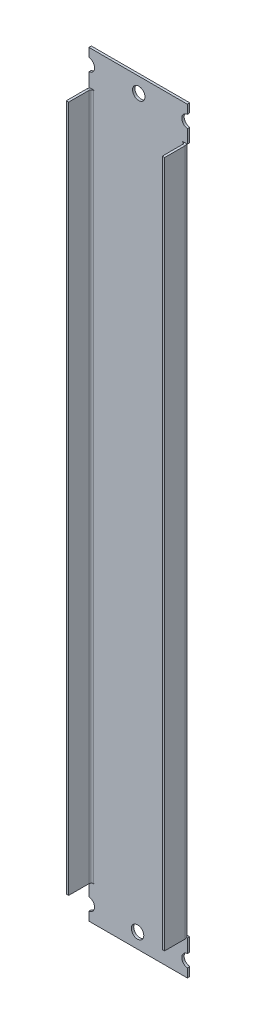
from build123d import *

# Parameters (mm, degrees)
CROQUIS1_W                          = 62.738
CROQUIS1_H                          = 482.6
CROQUIS1_R                          = 3.9624
BRIDA_BASE1_DEPTH                   = 1.524
BRIDA_DE_ARISTA1_STRIP_W            = 9.144
BRIDA_DE_ARISTA1_STRIP_H            = 1.524
BRIDA_DE_ARISTA1_STRIP_CUT_DEPTH    = 438.15
BRIDA_DE_ARISTA1_RELIEF_W           = 9.2964
BRIDA_DE_ARISTA1_RELIEF_H           = 0.1524
BRIDA_DE_ARISTA1_RELIEF_CUT_DEPTH   = 1.524
BRIDA_DE_ARISTA1_STRIP_2_W          = 9.144
BRIDA_DE_ARISTA1_STRIP_2_H          = 1.524
BRIDA_DE_ARISTA1_STRIP_CUT_2_DEPTH  = 438.15
BRIDA_DE_ARISTA1_RELIEF_2_W         = 9.2964
BRIDA_DE_ARISTA1_RELIEF_2_H         = 0.1524
BRIDA_DE_ARISTA1_RELIEF_CUT_2_DEPTH = 1.524
BRIDA_DE_ARISTA1_DEPTH              = 438.15
BRIDA_DE_ARISTA1_BEND_DEPTH         = 438.15
CROQUIS15_R                         = 3.9624
CORTAR_EXTRUIR1_DEPTH               = 244.760777495


# Sheet-metal steps are written as plain solids
with BuildPart() as part:
    # Croquis1 → Brida base1 (new body)
    with BuildSketch(Plane.XY):
        Rectangle(CROQUIS1_W, CROQUIS1_H)
        with Locations((0.381, 231.775)):
            Circle(CROQUIS1_R, mode=Mode.SUBTRACT)
        with Locations((-0.381, -231.775)):
            Circle(CROQUIS1_R, mode=Mode.SUBTRACT)
    extrude(amount=-BRIDA_BASE1_DEPTH)

    # Brida de arista1 strip (across the edge) → Brida de arista1 strip cut (cut)
    with BuildSketch(Plane(origin=(31.369, -219.075, 0), x_dir=(-1, 0, 0), z_dir=(0, 1, 0))):
        with Locations((-1.524, -0.762)):
            Rectangle(BRIDA_DE_ARISTA1_STRIP_W, BRIDA_DE_ARISTA1_STRIP_H)
    extrude(amount=BRIDA_DE_ARISTA1_STRIP_CUT_DEPTH, mode=Mode.SUBTRACT)

    # Brida de arista1 relief (on the sheet) → Brida de arista1 relief cut (cut)
    with BuildSketch(Plane(origin=(28.321, -219.075, 0), x_dir=(-1, 0, 0), z_dir=(0, 0, 1))):
        with Locations((-4.4958, 0.0762)):
            Rectangle(BRIDA_DE_ARISTA1_RELIEF_W, BRIDA_DE_ARISTA1_RELIEF_H)
        with Locations((-4.4958, -438.2262)):
            Rectangle(BRIDA_DE_ARISTA1_RELIEF_W, BRIDA_DE_ARISTA1_RELIEF_H)
    extrude(amount=-BRIDA_DE_ARISTA1_RELIEF_CUT_DEPTH, mode=Mode.SUBTRACT)

    # Brida de arista1 strip 2 (across the edge) → Brida de arista1 strip cut 2 (cut)
    with BuildSketch(Plane(origin=(-31.369, 219.075, 0), x_dir=(1, 0, 0), z_dir=(0, -1, 0))):
        with Locations((-1.524, -0.762)):
            Rectangle(BRIDA_DE_ARISTA1_STRIP_2_W, BRIDA_DE_ARISTA1_STRIP_2_H)
    extrude(amount=BRIDA_DE_ARISTA1_STRIP_CUT_2_DEPTH, mode=Mode.SUBTRACT)

    # Brida de arista1 relief 2 (on the sheet) → Brida de arista1 relief cut 2 (cut)
    with BuildSketch(Plane(origin=(-28.321, 219.075, 0), x_dir=(1, 0, 0), z_dir=(0, 0, 1))):
        with Locations((-4.4958, 0.0762)):
            Rectangle(BRIDA_DE_ARISTA1_RELIEF_2_W, BRIDA_DE_ARISTA1_RELIEF_2_H)
        with Locations((-4.4958, -438.2262)):
            Rectangle(BRIDA_DE_ARISTA1_RELIEF_2_W, BRIDA_DE_ARISTA1_RELIEF_2_H)
    extrude(amount=-BRIDA_DE_ARISTA1_RELIEF_CUT_2_DEPTH, mode=Mode.SUBTRACT)

    # Brida de arista1 section (across the edge) → Brida de arista1 (add)
    with BuildSketch(Plane(origin=(31.369, -219.075, 0), x_dir=(-1, 0, 0), z_dir=(0, 1, 0))):
        with BuildLine():
            Line((0, 1.524), (0, 14.478))
            Line((0, 14.478), (1.524, 14.478))
            Line((1.524, 14.478), (1.524, 1.524))
            ThreePointArc((1.524, 1.524), (1.970369265, 0.446369265), (3.048, 0))
            Line((3.048, 0), (3.048, -1.524))
            ThreePointArc((3.048, -1.524), (0.892738531, -0.631261469), (0, 1.524))
        make_face()
    extrude(amount=BRIDA_DE_ARISTA1_DEPTH)

    # Brida de arista1 section 2 (across the edge) → Brida de arista1 bend (add)
    with BuildSketch(Plane(origin=(-31.369, 219.075, 0), x_dir=(1, 0, 0), z_dir=(0, -1, 0))):
        with BuildLine():
            Line((0, 1.524), (0, 14.478))
            Line((0, 14.478), (1.524, 14.478))
            Line((1.524, 14.478), (1.524, 1.524))
            ThreePointArc((1.524, 1.524), (1.970369265, 0.446369265), (3.048, 0))
            Line((3.048, 0), (3.048, -1.524))
            ThreePointArc((3.048, -1.524), (0.892738531, -0.631261469), (0, 1.524))
        make_face()
    extrude(amount=BRIDA_DE_ARISTA1_BEND_DEPTH)

    # Croquis15 → Cortar-Extruir1 (cut, through all)
    with BuildSketch(Plane.XY):
        with Locations((-31.7754, 231.775)):
            Circle(CROQUIS15_R)
        with Locations((-31.7754, -231.775)):
            Circle(CROQUIS15_R)
        with Locations((31.7754, -231.775)):
            Circle(CROQUIS15_R)
        with Locations((31.7754, 231.775)):
            Circle(CROQUIS15_R)
    extrude(amount=-CORTAR_EXTRUIR1_DEPTH, mode=Mode.SUBTRACT)


solid = part.part
